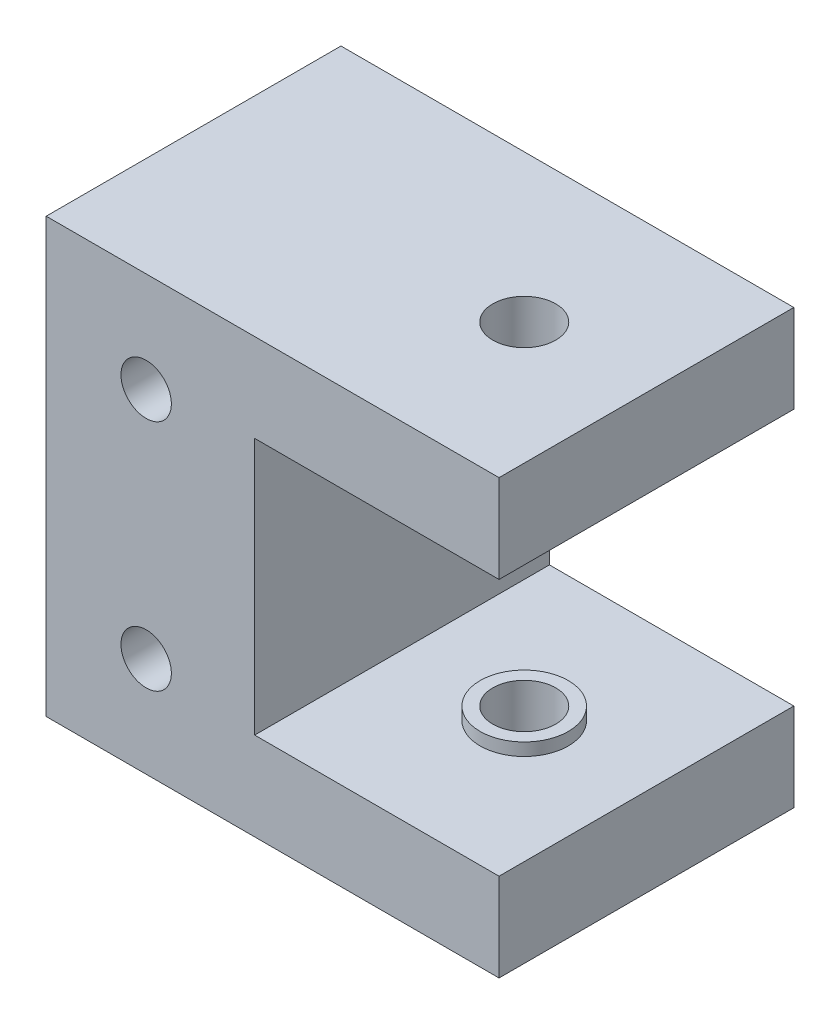
from build123d import *

# Parameters (mm, degrees)
MAINBLOCK_R                     = 2
MAINBLOCKBOSS_EXTRUDE1_DEPTH    = 23.4
TOPHOLECUT_SKETCH2_R            = 2.5
TOPHOLECUT_EXTRUDE1_DEPTH       = 30
TOPSPACERSKETCH4_R              = 3.5
TOPSPACERSKETCH4_R_2            = 2.5
TOPSPACERBOSS_EXTRUDE2_DEPTH    = 1
LOWERSPACERBOSS_EXTRUDE3_START  = 1
LOWERSPACERSKETCH5_R            = 3.5
LOWERSPACERSKETCH5_R_2          = 2.5
LOWERSPACERBOSS_EXTRUDE3_DEPTH  = 1
MOUNTHOLEBORECUT_EXTRUDE1_DEPTH = 2
PUSHPINHOLESKETCH1_R            = 1
PUSHPINHOLECUT_EXTRUDE1_DEPTH   = 55.984747885


with BuildPart() as part:
    # MainBlock → MainBlockBoss-Extrude1 (new body)
    with BuildSketch(Plane.XY):
        Polygon((0, 0), (35.95, 0), (35.95, 7), (16.55, 7), (16.55, 27.4), (35.95, 27.4), (35.95, 34.4), (0, 34.4), align=None)
        with Locations((7.9375, 26.4625)):
            Circle(MAINBLOCK_R, mode=Mode.SUBTRACT)
        with Locations((7.9375, 7.9375)):
            Circle(MAINBLOCK_R, mode=Mode.SUBTRACT)
    extrude(amount=MAINBLOCKBOSS_EXTRUDE1_DEPTH)

    # TopHoleCut-Sketch2 → TopHoleCut-Extrude1 (cut)
    with BuildSketch(Plane(origin=(0, 34.4, 0), x_dir=(1, 0, 0), z_dir=(0, 1, 0))):
        with Locations((26.25, -11.7)):
            Circle(TOPHOLECUT_SKETCH2_R)
    extrude(amount=-TOPHOLECUT_EXTRUDE1_DEPTH, mode=Mode.SUBTRACT)

    # TopSpacerSketch4 → TopSpacerBoss-Extrude2 (add)
    with BuildSketch(Plane.XZ.offset(-27.4)):
        with Locations((26.25, 11.7)):
            Circle(TOPSPACERSKETCH4_R)
        with Locations((26.25, 11.7)):
            Circle(TOPSPACERSKETCH4_R_2, mode=Mode.SUBTRACT)
    extrude(amount=TOPSPACERBOSS_EXTRUDE2_DEPTH)

    # LowerSpacerSketch5 → LowerSpacerBoss-Extrude3 (add)
    with BuildSketch(Plane(origin=(0, 7, 0), x_dir=(1, 0, 0), z_dir=(0, 1, 0)).offset(LOWERSPACERBOSS_EXTRUDE3_START)):
        with Locations((26.25, -11.7)):
            Circle(LOWERSPACERSKETCH5_R)
        with Locations((26.25, -11.7)):
            Circle(LOWERSPACERSKETCH5_R_2, mode=Mode.SUBTRACT)
    extrude(amount=-LOWERSPACERBOSS_EXTRUDE3_DEPTH)

    # MountHoleBoreSketch1 → MountHoleBoreCut-Extrude1 (cut)
    with BuildSketch(Plane(origin=(0, 0, 0), x_dir=(-1, 0, 0), z_dir=(0, 0, -1))):
        Polygon((-4.0625, 26.4625), (-6, 29.81834844), (-9.875, 29.81834844), (-11.8125, 26.4625), (-9.875, 23.10665156), (-6, 23.10665156), align=None)
        Polygon((-4.0625, 7.9375), (-6, 11.29334844), (-9.875, 11.29334844), (-11.8125, 7.9375), (-9.875, 4.58165156), (-6, 4.58165156), align=None)
    extrude(amount=-MOUNTHOLEBORECUT_EXTRUDE1_DEPTH, mode=Mode.SUBTRACT)

    # PushPinHoleSketch1 → PushPinHoleCut-Extrude1 (cut, through all)
    with BuildSketch(Plane.XZ):
        with Locations((26.25, 11.7)):
            Circle(PUSHPINHOLESKETCH1_R)
    extrude(amount=-PUSHPINHOLECUT_EXTRUDE1_DEPTH, mode=Mode.SUBTRACT)


solid = part.part
